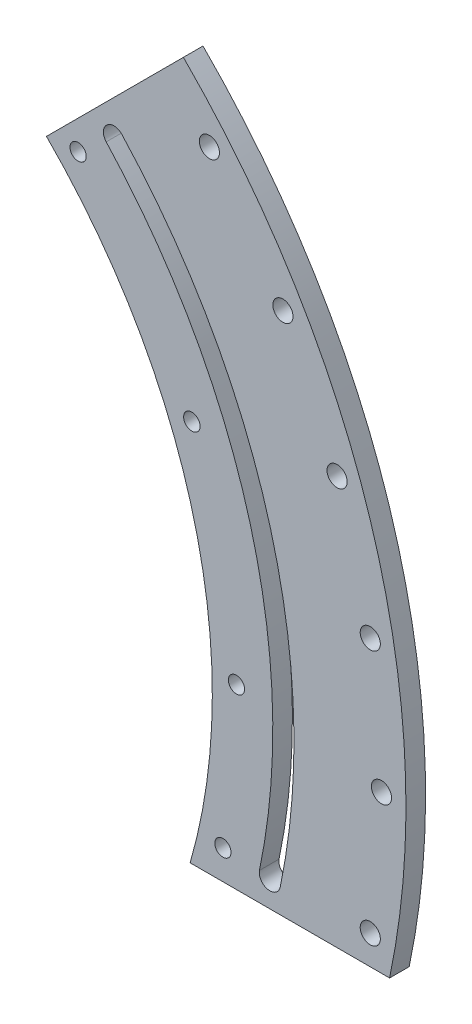
from build123d import *

# Parameters (mm, degrees)
SKETCH1_R           = 2.6289
SKETCH1_R_2         = 3.2639
SKETCH1_R_3         = 2.667
BOSS_EXTRUDE1_DEPTH = 6.35


with BuildPart() as part:
    # Sketch1 → Boss-Extrude1 (new body)
    with BuildSketch(Plane.XY):
        with BuildLine():
            ThreePointArc((183.35625, 0), (181.552952325, -25.652288715), (176.178529946, -50.8))
            Line((176.178529946, -50.8), (240.761529124, -50.8))
            ThreePointArc((240.761529124, -50.8), (235.877364624, 70.061564101), (173.992462346, 173.992462346))
            Line((173.992462346, 173.992462346), (129.652447748, 129.652447748))
            ThreePointArc((129.652447748, 129.652447748), (169.399086533, 70.167399096), (183.35625, 0))
        make_face()
        with Locations((186.787775735, -41.275)):
            Circle(SKETCH1_R, mode=Mode.SUBTRACT)
        with BuildLine():
            ThreePointArc((198.61336608, -41.711026485), (201.859935486, -20.967721902), (202.946, 0))
            ThreePointArc((202.946, 0), (188.979042117, 73.986489014), (149.000610029, 137.789321528))
            ThreePointArc((149.000610029, 137.789321528), (149.190037306, 142.634958669), (154.035674448, 142.445531392))
            ThreePointArc((154.035674448, 142.445531392), (195.36506732, 76.486658229), (209.804, 0))
            ThreePointArc((209.804, 0), (208.692287116, -21.569601625), (205.368929989, -42.910616532))
            ThreePointArc((205.368929989, -42.910616532), (201.391341659, -45.688667392), (198.61336608, -41.711026485))
        make_face(mode=Mode.SUBTRACT)
        with Locations((234.507346186, -41.349972307)):
            Circle(SKETCH1_R_2, mode=Mode.SUBTRACT)
        with Locations((238.125, 0)):
            Circle(SKETCH1_R_2, mode=Mode.SUBTRACT)
        with Locations((191.177219016, 6.676055597)):
            Circle(SKETCH1_R, mode=Mode.SUBTRACT)
        with Locations((234.507346186, 41.349972307)):
            Circle(SKETCH1_R_2, mode=Mode.SUBTRACT)
        with Locations((176.732380322, 73.20494884)):
            Circle(SKETCH1_R_3, mode=Mode.SUBTRACT)
        with Locations((139.903392159, 130.46202379)):
            Circle(SKETCH1_R, mode=Mode.SUBTRACT)
        with Locations((182.414333018, 153.063799557)):
            Circle(SKETCH1_R_2, mode=Mode.SUBTRACT)
        with Locations((223.764305325, 81.443546629)):
            Circle(SKETCH1_R_2, mode=Mode.SUBTRACT)
        with Locations((206.222299276, 119.0625)):
            Circle(SKETCH1_R_2, mode=Mode.SUBTRACT)
    extrude(amount=BOSS_EXTRUDE1_DEPTH)


solid = part.part
